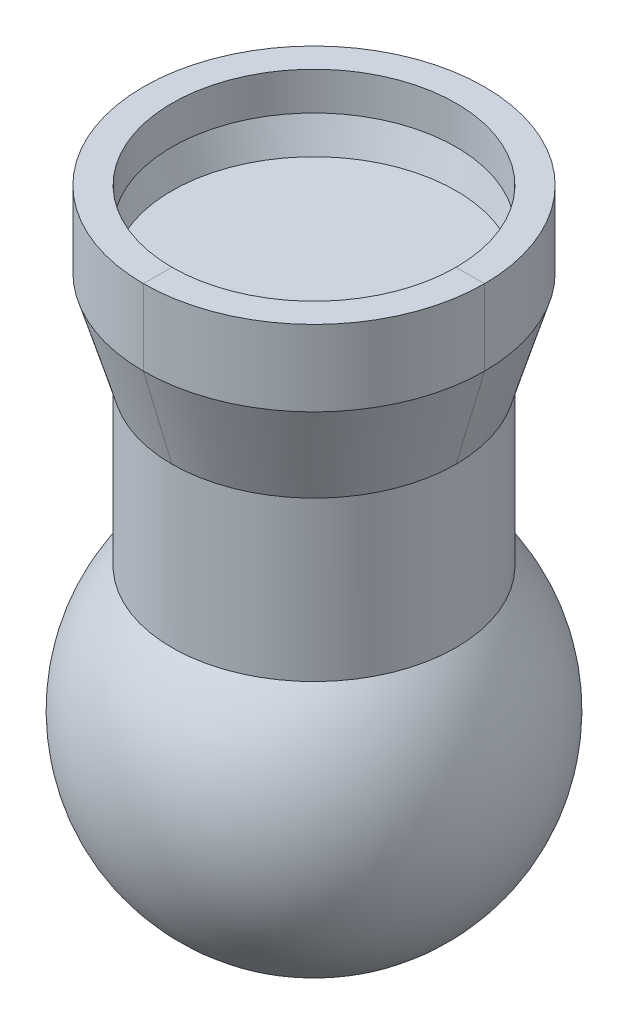
from build123d import *

# Parameters (mm, degrees)
SKETCH_3_R      = 7.5
EXTRUDE_1_DEPTH = 20


with BuildPart() as part:
    # 扫描1: sweep along a path in 草图2
    with BuildLine(Plane(origin=(0, 0, 0), x_dir=(1, 0, 0), z_dir=(0, 1, 0))) as sweep_1_path:
        CenterArc((0, 0), 10, 0, 360)
    # 草图1 → 扫描1 (sweep)
    with BuildSketch(Plane.XY):
        with BuildLine():
            Line((0, 10), (0, -10))
            ThreePointArc((0, -10), (10, 0), (0, 10))
        make_face()
    sweep(path=sweep_1_path.line)

    # 草图3 → 凸台-拉伸1 (add)
    with BuildSketch(Plane(origin=(0, 0, 0), x_dir=(1, 0, 0), z_dir=(0, 1, 0))):
        Circle(SKETCH_3_R)
    extrude(amount=EXTRUDE_1_DEPTH)

    # 扫描2: sweep along a curve in space
    with BuildLine() as sweep_2_path:
        ThreePointArc((0, 20, 7.5), (5.303300859, 20, 5.303300859), (7.5, 20, 0))
        ThreePointArc((7.5, 20, 0), (5.303300859, 20, -5.303300859), (0, 20, -7.5))
        ThreePointArc((0, 20, -7.5), (-5.303300859, 20, -5.303300859), (-7.5, 20, 0))
        ThreePointArc((-7.5, 20, 0), (-5.303300859, 20, 5.303300859), (0, 20, 7.5))
    # 草图4 → 扫描2 (sweep)
    with BuildSketch(Plane.XY):
        Polygon((7.5, 22), (8.3, 22), (7.5, 20), (7.5, 15), (9, 20), (9, 24), (7.5, 24), align=None)
    sweep(path=sweep_2_path.line)


solid = part.part
